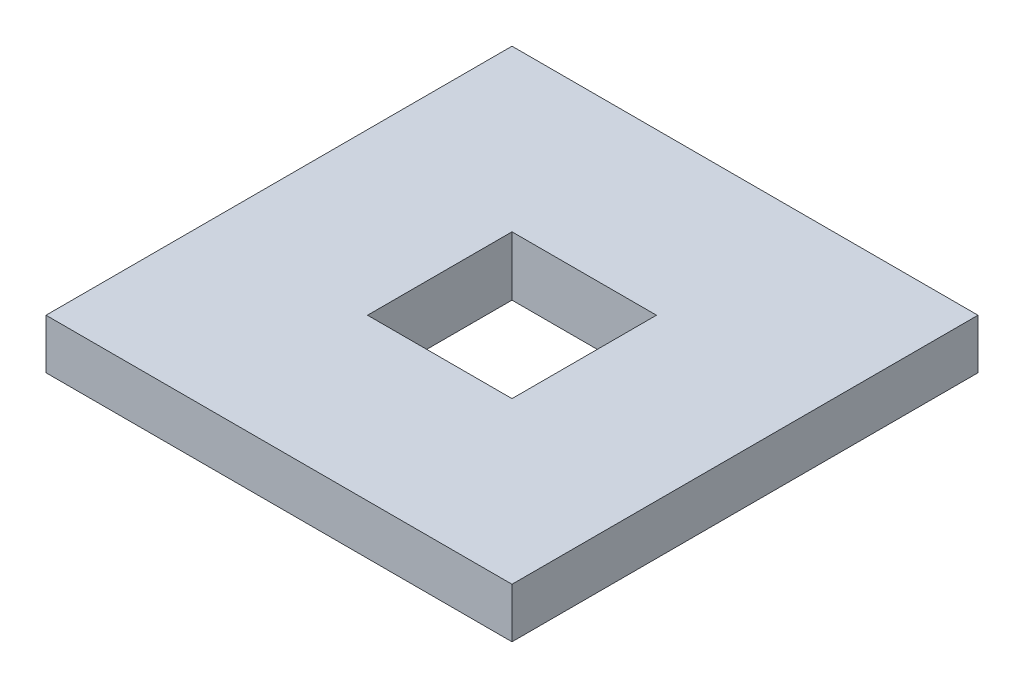
from build123d import *

# Parameters (mm, degrees)
SKETCH1_W           = 25
SKETCH1_H           = 25
SKETCH1_W_2         = 7.75
SKETCH1_H_2         = 7.75
BOSS_EXTRUDE1_DEPTH = 3.175
SKETCH4_W           = 25
SKETCH4_H           = 25
CUT_EXTRUDE1_DEPTH  = 0.5


with BuildPart() as part:
    # Sketch1 → Boss-Extrude1 (new body)
    with BuildSketch(Plane(origin=(0, 0, 0), x_dir=(1, 0, 0), z_dir=(0, 1, 0))):
        with Locations((12.5, 12.5)):
            Rectangle(SKETCH1_W, SKETCH1_H)
        with Locations((12.5, 12.5)):
            Rectangle(SKETCH1_W_2, SKETCH1_H_2, mode=Mode.SUBTRACT)
    extrude(amount=BOSS_EXTRUDE1_DEPTH)

    # Sketch4 → Cut-Extrude1 (cut)
    with BuildSketch(Plane.XZ):
        with Locations((12.5, -12.5)):
            Rectangle(SKETCH4_W, SKETCH4_H)
        with BuildLine():
            Line((5.175, -2), (19.825, -2))
            ThreePointArc((19.825, -2), (22.07006403, -2.92993597), (23, -5.175))
            Line((23, -5.175), (23, -19.825))
            ThreePointArc((23, -19.825), (22.07006403, -22.07006403), (19.825, -23))
            Line((19.825, -23), (5.175, -23))
            ThreePointArc((5.175, -23), (2.92993597, -22.07006403), (2, -19.825))
            Line((2, -19.825), (2, -5.175))
            ThreePointArc((2, -5.175), (2.92993597, -2.92993597), (5.175, -2))
        make_face(mode=Mode.SUBTRACT)
    extrude(amount=-CUT_EXTRUDE1_DEPTH, mode=Mode.SUBTRACT)


solid = part.part
